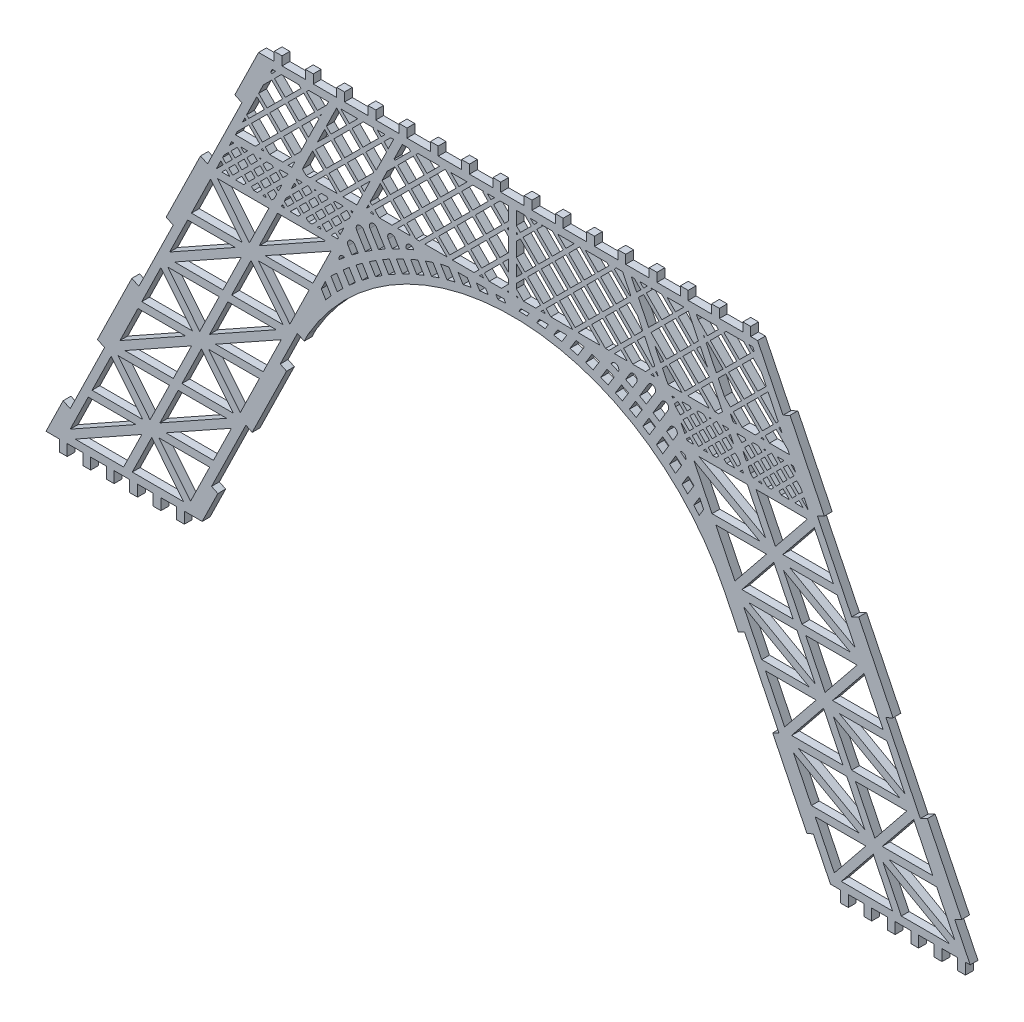
from build123d import *

# Parameters (mm, degrees)
BOSS_EXTRUDE1_DEPTH = 3


with BuildPart() as part:
    # Sketch1 → Boss-Extrude1 (new body)
    with BuildSketch(Plane.XY):
        with BuildLine():
            Line((95.389694534, 192.970900019), (92.969418566, 194.155421923))
            Line((92.969418566, 194.155421923), (99.563302279, 207.628383646))
            Line((99.563302279, 207.628383646), (102.17945353, 206.347997234))
            Line((102.17945353, 206.347997234), (103.652227216, 209.357244041))
            ThreePointArc((103.652227216, 209.357244041), (185.300477119, 254.57931336), (263.61828912, 203.807346792))
            Line((263.61828912, 203.807346792), (268.921820099, 192.97090002))
            Line((268.921820099, 192.97090002), (271.342096067, 194.155421924))
            Line((271.342096067, 194.155421924), (284.529863492, 167.209498479))
            Line((284.529863492, 167.209498479), (282.109587524, 166.024976574))
            Line((282.109587524, 166.024976574), (295.297354949, 139.079053128))
            Line((295.297354949, 139.079053128), (297.717630917, 140.263575033))
            Line((297.717630917, 140.263575033), (304.31151463, 126.79061331))
            Line((304.31151463, 126.79061331), (308.155757317, 126.79061331))
            Line((308.155757317, 126.79061331), (308.155757317, 122.449462059))
            Line((308.155757317, 122.449462059), (311.155757317, 122.449462059))
            Line((311.155757317, 122.449462059), (311.155757317, 126.79061331))
            Line((311.155757317, 126.79061331), (317.155757317, 126.79061331))
            Line((317.155757317, 126.79061331), (317.155757317, 122.449462059))
            Line((317.155757317, 122.449462059), (320.155757317, 122.449462059))
            Line((320.155757317, 122.449462059), (320.155757317, 126.79061331))
            Line((320.155757317, 126.79061331), (326.155757317, 126.79061331))
            Line((326.155757317, 126.79061331), (326.155757317, 122.449462059))
            Line((326.155757317, 122.449462059), (329.155757317, 122.449462059))
            Line((329.155757317, 122.449462059), (329.155757317, 126.79061331))
            Line((329.155757317, 126.79061331), (335.155757317, 126.79061331))
            Line((335.155757317, 126.79061331), (335.155757317, 122.449462059))
            Line((335.155757317, 122.449462059), (338.155757317, 122.449462059))
            Line((338.155757317, 122.449462059), (338.155757317, 126.79061331))
            Line((338.155757317, 126.79061331), (344.155757317, 126.79061331))
            Line((344.155757317, 126.79061331), (344.155757317, 122.449462059))
            Line((344.155757317, 122.449462059), (347.155757317, 122.449462059))
            Line((347.155757317, 122.449462059), (347.155757317, 126.79061331))
            Line((347.155757317, 126.79061331), (353.155757317, 126.79061331))
            Line((353.155757317, 126.79061331), (353.155757317, 122.449462059))
            Line((353.155757317, 122.449462059), (356.155757317, 122.449462059))
            Line((356.155757317, 122.449462059), (356.155757317, 126.790613309))
            Line((356.155757317, 126.790613309), (357.971491781, 126.790613309))
            Line((357.971491781, 126.790613309), (352.023038573, 138.944798289))
            Line((352.023038573, 138.944798289), (354.717630917, 140.263575032))
            Line((354.717630917, 140.263575032), (341.529863492, 167.209498478))
            Line((341.529863492, 167.209498478), (338.835271148, 165.890721735))
            Line((338.835271148, 165.890721735), (325.647503722, 192.836645181))
            Line((325.647503722, 192.836645181), (328.342096067, 194.155421923))
            Line((328.342096067, 194.155421923), (315.154328642, 221.101345369))
            Line((315.154328642, 221.101345369), (312.459736297, 219.782568627))
            Line((312.459736297, 219.782568627), (299.271968872, 246.728492072))
            Line((299.271968872, 246.728492072), (301.966561217, 248.047268815))
            Line((301.966561217, 248.047268815), (288.778793792, 274.99319226))
            Line((288.778793792, 274.99319226), (286.084201447, 273.674415518))
            Line((286.084201447, 273.674415518), (276.315734467, 293.633848751))
            Line((276.315734467, 293.633848751), (273.655757317, 293.633848751))
            Line((273.655757317, 293.633848751), (273.655757317, 297.000000002))
            Line((273.655757317, 297.000000002), (270.655757317, 297.000000002))
            Line((270.655757317, 297.000000002), (270.655757317, 293.633848751))
            Line((270.655757317, 293.633848751), (261.655757317, 293.633848751))
            Line((261.655757317, 293.633848751), (261.655757317, 297.000000002))
            Line((261.655757317, 297.000000002), (258.655757317, 297.000000002))
            Line((258.655757317, 297.000000002), (258.655757317, 293.633848751))
            Line((258.655757317, 293.633848751), (249.655757317, 293.633848751))
            Line((249.655757317, 293.633848751), (249.655757317, 297.000000002))
            Line((249.655757317, 297.000000002), (246.655757317, 297.000000002))
            Line((246.655757317, 297.000000002), (246.655757317, 293.633848751))
            Line((246.655757317, 293.633848751), (237.655757317, 293.633848751))
            Line((237.655757317, 293.633848751), (237.655757317, 297.000000002))
            Line((237.655757317, 297.000000002), (234.655757317, 297.000000002))
            Line((234.655757317, 297.000000002), (234.655757317, 293.633848751))
            Line((234.655757317, 293.633848751), (225.655757317, 293.633848751))
            Line((225.655757317, 293.633848751), (225.655757317, 297.000000002))
            Line((225.655757317, 297.000000002), (222.655757317, 297.000000002))
            Line((222.655757317, 297.000000002), (222.655757317, 293.633848751))
            Line((222.655757317, 293.633848751), (213.655757317, 293.633848751))
            Line((213.655757317, 293.633848751), (213.655757317, 297.000000002))
            Line((213.655757317, 297.000000002), (210.655757317, 297.000000002))
            Line((210.655757317, 297.000000002), (210.655757317, 293.633848751))
            Line((210.655757317, 293.633848751), (201.655757317, 293.633848751))
            Line((201.655757317, 293.633848751), (201.655757317, 297.000000002))
            Line((201.655757317, 297.000000002), (198.655757317, 297.000000002))
            Line((198.655757317, 297.000000002), (198.655757317, 293.633848751))
            Line((198.655757317, 293.633848751), (189.655757317, 293.633848751))
            Line((189.655757317, 293.633848751), (189.655757317, 297.000000002))
            Line((189.655757317, 297.000000002), (186.655757317, 297.000000002))
            Line((186.655757317, 297.000000002), (186.655757317, 293.633848751))
            Line((186.655757317, 293.633848751), (177.655757317, 293.633848751))
            Line((177.655757317, 293.633848751), (177.655757317, 297.000000002))
            Line((177.655757317, 297.000000002), (174.655757317, 297.000000002))
            Line((174.655757317, 297.000000002), (174.655757317, 293.633848751))
            Line((174.655757317, 293.633848751), (165.655757317, 293.633848751))
            Line((165.655757317, 293.633848751), (165.655757317, 297.000000002))
            Line((165.655757317, 297.000000002), (162.655757317, 297.000000002))
            Line((162.655757317, 297.000000002), (162.655757317, 293.633848751))
            Line((162.655757317, 293.633848751), (153.655757317, 293.633848751))
            Line((153.655757317, 293.633848751), (153.655757317, 297.000000002))
            Line((153.655757317, 297.000000002), (150.655757317, 297.000000002))
            Line((150.655757317, 297.000000002), (150.655757317, 293.633848751))
            Line((150.655757317, 293.633848751), (141.655757317, 293.633848751))
            Line((141.655757317, 293.633848751), (141.655757317, 297.000000002))
            Line((141.655757317, 297.000000002), (138.655757317, 297.000000002))
            Line((138.655757317, 297.000000002), (138.655757317, 293.633848751))
            Line((138.655757317, 293.633848751), (129.655757317, 293.633848751))
            Line((129.655757317, 293.633848751), (129.655757317, 297.000000002))
            Line((129.655757317, 297.000000002), (126.655757317, 297.000000002))
            Line((126.655757317, 297.000000002), (126.655757317, 293.633848751))
            Line((126.655757317, 293.633848751), (117.655757317, 293.633848751))
            Line((117.655757317, 293.633848751), (117.655757317, 297.000000002))
            Line((117.655757317, 297.000000002), (114.655757317, 297.000000002))
            Line((114.655757317, 297.000000002), (114.655757317, 293.633848751))
            Line((114.655757317, 293.633848751), (105.655757317, 293.633848751))
            Line((105.655757317, 293.633848751), (105.655757317, 297.000000002))
            Line((105.655757317, 297.000000002), (102.655757317, 297.000000002))
            Line((102.655757317, 297.000000002), (102.655757317, 293.633848751))
            Line((102.655757317, 293.633848751), (93.655757317, 293.633848751))
            Line((93.655757317, 293.633848751), (93.655757317, 297.000000002))
            Line((93.655757317, 297.000000002), (90.655757317, 297.000000002))
            Line((90.655757317, 297.000000002), (90.655757317, 293.633848751))
            Line((90.655757317, 293.633848751), (84.655757317, 293.633848751))
            Line((84.655757317, 293.633848751), (75.532720841, 274.99319226))
            Line((75.532720841, 274.99319226), (78.227313186, 273.674415518))
            Line((78.227313186, 273.674415518), (65.039545761, 246.728492072))
            Line((65.039545761, 246.728492072), (62.344953416, 248.047268815))
            Line((62.344953416, 248.047268815), (49.157185991, 221.101345369))
            Line((49.157185991, 221.101345369), (51.851778336, 219.782568627))
            Line((51.851778336, 219.782568627), (38.664010911, 192.836645181))
            Line((38.664010911, 192.836645181), (35.969418566, 194.155421923))
            Line((35.969418566, 194.155421923), (22.781651141, 167.209498478))
            Line((22.781651141, 167.209498478), (25.476243486, 165.890721735))
            Line((25.476243486, 165.890721735), (12.28847606, 138.944798289))
            Line((12.28847606, 138.944798289), (9.593883716, 140.263575032))
            Line((9.593883716, 140.263575032), (3.000000003, 126.790613309))
            Line((3.000000003, 126.790613309), (8.155757317, 126.790613309))
            Line((8.155757317, 126.790613309), (8.155757317, 122.449462058))
            Line((8.155757317, 122.449462058), (11.155757317, 122.449462058))
            Line((11.155757317, 122.449462058), (11.155757317, 126.790613309))
            Line((11.155757317, 126.790613309), (17.155757317, 126.790613309))
            Line((17.155757317, 126.790613309), (17.155757317, 122.449462058))
            Line((17.155757317, 122.449462058), (20.155757317, 122.449462058))
            Line((20.155757317, 122.449462058), (20.155757317, 126.790613309))
            Line((20.155757317, 126.790613309), (26.155757317, 126.790613309))
            Line((26.155757317, 126.790613309), (26.155757317, 122.449462058))
            Line((26.155757317, 122.449462058), (29.155757317, 122.449462058))
            Line((29.155757317, 122.449462058), (29.155757317, 126.790613309))
            Line((29.155757317, 126.790613309), (35.155757317, 126.790613309))
            Line((35.155757317, 126.790613309), (35.155757317, 122.449462058))
            Line((35.155757317, 122.449462058), (38.155757317, 122.449462058))
            Line((38.155757317, 122.449462058), (38.155757317, 126.790613309))
            Line((38.155757317, 126.790613309), (44.155757317, 126.790613309))
            Line((44.155757317, 126.790613309), (44.155757317, 122.449462058))
            Line((44.155757317, 122.449462058), (47.155757317, 122.449462058))
            Line((47.155757317, 122.449462058), (47.155757317, 126.790613309))
            Line((47.155757317, 126.790613309), (53.155757317, 126.790613309))
            Line((53.155757317, 126.790613309), (53.155757317, 122.449462058))
            Line((53.155757317, 122.449462058), (56.155757317, 122.449462058))
            Line((56.155757317, 122.449462058), (56.155757317, 126.790613309))
            Line((56.155757317, 126.790613309), (63.000000003, 126.790613309))
            Line((63.000000003, 126.790613309), (69.014159684, 139.079053127))
            Line((69.014159684, 139.079053127), (66.593883716, 140.263575032))
            Line((66.593883716, 140.263575032), (79.781651141, 167.209498478))
            Line((79.781651141, 167.209498478), (82.201927109, 166.024976573))
            Line((82.201927109, 166.024976573), (95.389694534, 192.970900019))
        make_face()
        Polygon((12.307657907, 132.159485469), (19.22365868, 146.290613307), (37.53128398, 146.290613307), align=None, mode=Mode.SUBTRACT)
        Polygon((32.798236726, 129.790613307), (14.217293325, 129.790613307), (39.817487821, 144.132707502), align=None, mode=Mode.SUBTRACT)
        Polygon((55.861501173, 129.790613307), (36.138259576, 129.790613307), (43.58903224, 145.014414528), align=None, mode=Mode.SUBTRACT)
        Polygon((65.863567283, 146.290613307), (58.51604494, 131.277778444), (46.413643786, 146.290613307), align=None, mode=Mode.SUBTRACT)
        Polygon((20.691906831, 149.290613307), (28.039429173, 164.303448171), (40.141830328, 149.290613307), align=None, mode=Mode.SUBTRACT)
        Polygon((50.417214538, 165.790613307), (42.966441874, 150.566812087), (30.69397294, 165.790613307), align=None, mode=Mode.SUBTRACT)
        Polygon((49.024190133, 149.290613307), (74.247816207, 163.421741145), (67.331815434, 149.290613307), align=None, mode=Mode.SUBTRACT)
        Polygon((72.338180788, 165.790613307), (46.737986293, 151.448519112), (53.757237387, 165.790613307), align=None, mode=Mode.SUBTRACT)
        Polygon((33.304519288, 168.790613307), (58.904713783, 183.132707502), (51.885462689, 168.790613307), align=None, mode=Mode.SUBTRACT)
        Polygon((56.618509943, 185.290613307), (31.394883869, 171.159485469), (38.310884642, 185.290613307), align=None, mode=Mode.SUBTRACT)
        Polygon((55.225485538, 168.790613307), (62.676258202, 184.014414528), (74.948727136, 168.790613307), align=None, mode=Mode.SUBTRACT)
        Polygon((84.950793246, 185.290613307), (77.603270903, 170.277778444), (65.500869748, 185.290613307), align=None, mode=Mode.SUBTRACT)
        Polygon((39.779132793, 188.290613307), (47.126655136, 203.303448171), (59.22905629, 188.290613307), align=None, mode=Mode.SUBTRACT)
        Polygon((69.504440501, 204.790613307), (62.053667836, 189.566812087), (49.781198903, 204.790613307), align=None, mode=Mode.SUBTRACT)
        Polygon((91.425406751, 204.790613307), (65.825212255, 190.448519112), (72.84446335, 204.790613307), align=None, mode=Mode.SUBTRACT)
        Polygon((68.111416096, 188.290613307), (93.33504217, 202.421741145), (86.419041397, 188.290613307), align=None, mode=Mode.SUBTRACT)
        Polygon((317.897870841, 146.290613307), (305.795469686, 131.277778444), (298.447947343, 146.290613307), align=None, mode=Mode.SUBTRACT)
        Polygon((308.450013453, 129.790613307), (320.722482387, 145.014414528), (328.173255051, 129.790613307), align=None, mode=Mode.SUBTRACT)
        Polygon((324.494026806, 144.132707502), (350.094221301, 129.790613307), (331.5132779, 129.790613307), align=None, mode=Mode.SUBTRACT)
        Polygon((352.00385672, 132.159485469), (326.780230646, 146.290613307), (345.087855947, 146.290613307), align=None, mode=Mode.SUBTRACT)
        Polygon((290.063698419, 163.421741145), (315.287324493, 149.290613307), (296.979699192, 149.290613307), align=None, mode=Mode.SUBTRACT)
        Polygon((310.554277239, 165.790613307), (317.573528334, 151.448519112), (291.973333838, 165.790613307), align=None, mode=Mode.SUBTRACT)
        Polygon((333.617541686, 165.790613307), (321.345072753, 150.566812087), (313.894300088, 165.790613307), align=None, mode=Mode.SUBTRACT)
        Polygon((324.169684298, 149.290613307), (336.272085453, 164.303448171), (343.619607796, 149.290613307), align=None, mode=Mode.SUBTRACT)
        Polygon((289.36278749, 168.790613307), (301.635256424, 184.014414528), (309.086029088, 168.790613307), align=None, mode=Mode.SUBTRACT)
        Polygon((298.810644878, 185.290613307), (286.708243724, 170.277778444), (279.360721381, 185.290613307), align=None, mode=Mode.SUBTRACT)
        Polygon((312.426051937, 168.790613307), (305.406800843, 183.132707502), (331.006995339, 168.790613307), align=None, mode=Mode.SUBTRACT)
        Polygon((332.916630757, 171.159485469), (307.693004684, 185.290613307), (326.000629984, 185.290613307), align=None, mode=Mode.SUBTRACT)
        Polygon((270.976472457, 202.421741145), (296.20009853, 188.290613307), (277.89247323, 188.290613307), align=None, mode=Mode.SUBTRACT)
        Polygon((291.467051277, 204.790613307), (298.486302371, 190.448519112), (272.886107875, 204.790613307), align=None, mode=Mode.SUBTRACT)
        Polygon((314.530315724, 204.790613307), (302.25784679, 189.566812087), (294.807074126, 204.790613307), align=None, mode=Mode.SUBTRACT)
        Polygon((305.082458336, 188.290613307), (317.18485949, 203.303448171), (324.532381833, 188.290613307), align=None, mode=Mode.SUBTRACT)
        Polygon((52.39174525, 207.790613307), (77.991939746, 222.132707502), (70.972688652, 207.790613307), align=None, mode=Mode.SUBTRACT)
        Polygon((75.705735905, 224.290613307), (50.482109832, 210.159485469), (57.398110605, 224.290613307), align=None, mode=Mode.SUBTRACT)
        Polygon((74.312711501, 207.790613307), (81.763484165, 223.014414528), (94.035953099, 207.790613307), align=None, mode=Mode.SUBTRACT)
        Polygon((58.866358756, 227.290613307), (66.213881099, 242.303448171), (78.316282253, 227.290613307), align=None, mode=Mode.SUBTRACT)
        Polygon((68.868424865, 243.790613307), (88.591666463, 243.790613307), (81.140893799, 228.566812087), align=None, mode=Mode.SUBTRACT)
        Polygon((70.531292081, 246.790613307), (72.095631909, 248.354953136), (73.659971737, 246.790613307), align=None, mode=Mode.SUBTRACT)
        Polygon((86.281292081, 246.790613307), (86.994027811, 247.503349038), (87.706763542, 246.790613307), align=None, mode=Mode.SUBTRACT)
        Polygon((68.409971737, 246.790613307), (70.135100363, 250.315484682), (71.034971737, 249.415613307), align=None, mode=Mode.SUBTRACT)
        Polygon((78.909971737, 246.790613307), (75.781292081, 246.790613307), (78.23232986, 249.241651087), (79.796669688, 247.677311259), align=None, mode=Mode.SUBTRACT)
        Polygon((77.171669688, 250.302311259), (74.720631909, 247.851273479), (73.156292081, 249.415613307), (75.60732986, 251.866651087), align=None, mode=Mode.SUBTRACT)
        Polygon((74.546669688, 252.927311259), (72.095631909, 250.476273479), (70.832157591, 251.739747797), (71.408941918, 252.918263145), (72.98232986, 254.491651087), align=None, mode=Mode.SUBTRACT)
        Polygon((84.159971737, 246.790613307), (82.804687983, 246.790613307), (81.917990032, 247.677311259), (84.369027811, 250.128349038), (85.933367639, 248.56400921), align=None, mode=Mode.SUBTRACT)
        Polygon((90.68291202, 248.06355359), (89.619027811, 246.999669382), (88.054687983, 248.56400921), (90.505725762, 251.015046989), (91.594538052, 249.9262347), align=None, mode=Mode.SUBTRACT)
        Polygon((83.308367639, 251.18900921), (80.85732986, 248.73797143), (79.292990032, 250.302311259), (81.744027811, 252.753349038), align=None, mode=Mode.SUBTRACT)
        Polygon((89.445065591, 252.075707161), (86.994027811, 249.624669382), (85.429687983, 251.18900921), (87.880725763, 253.640046989), align=None, mode=Mode.SUBTRACT)
        Polygon((84.588095711, 224.290613307), (104.038019208, 224.290613307), (96.690496865, 209.277778444), align=None, mode=Mode.SUBTRACT)
        Polygon((110.293086177, 230.246781108), (112.509965815, 226.614619747), (110.444425921, 224.240392777), (108.729001795, 227.0509636), align=None, mode=Mode.SUBTRACT)
        Polygon((87.198642059, 227.290613307), (112.422268132, 241.421741145), (105.506267359, 227.290613307), align=None, mode=Mode.SUBTRACT)
        Polygon((91.931689312, 243.790613307), (110.512632714, 243.790613307), (84.912438218, 229.448519112), align=None, mode=Mode.SUBTRACT)
        with BuildLine():
            Line((114.864758938, 229.136296505), (112.45445198, 233.085371436))
            ThreePointArc((112.45445198, 233.085371436), (112.450667955, 233.091605251), (112.446914282, 233.097857388))
            ThreePointArc((112.446914282, 233.097857388), (113.481717873, 234.125502772), (114.531669295, 235.137666553))
            ThreePointArc((114.531669295, 235.137666553), (114.801851679, 234.921073967), (115.015167427, 234.648297025))
            Line((115.015167427, 234.648297025), (117.048409895, 231.317008944))
            ThreePointArc((117.048409895, 231.317008944), (115.947605482, 230.235643758), (114.864758938, 229.136296505))
        make_face(mode=Mode.SUBTRACT)
        with BuildLine():
            ThreePointArc((117.147771285, 237.534011264), (118.294330407, 238.531095028), (119.45618054, 239.510318251))
            Line((119.45618054, 239.510318251), (121.826493203, 235.626770439))
            ThreePointArc((121.826493203, 235.626770439), (120.670412948, 234.637729822), (119.530544539, 233.630047875))
            Line((119.530544539, 233.630047875), (117.147771285, 237.534011264))
        make_face(mode=Mode.SUBTRACT)
        with BuildLine():
            ThreePointArc((115.597233558, 240.164956685), (116.060636319, 241.746527754), (117.696330197, 241.948058653))
            ThreePointArc((117.696330197, 241.948058653), (116.640715332, 241.063649305), (115.597233558, 240.164956685))
        make_face(mode=Mode.SUBTRACT)
        with BuildLine():
            ThreePointArc((122.07120672, 241.605626144), (123.270085298, 242.518477897), (124.482830413, 243.412825398))
            Line((124.482830413, 243.412825398), (126.835056521, 239.558910807))
            ThreePointArc((126.835056521, 239.558910807), (125.625543645, 238.659058162), (124.430665213, 237.739861931))
            Line((124.430665213, 237.739861931), (122.07120672, 241.605626144))
        make_face(mode=Mode.SUBTRACT)
        Polygon((93.399937463, 246.790613307), (93.837042991, 247.683729761), (94.695065591, 246.825707161), (94.659971737, 246.790613307), align=None, mode=Mode.SUBTRACT)
        Polygon((107.281292081, 246.790613307), (108.029121665, 247.538442892), (108.776951249, 246.790613307), align=None, mode=Mode.SUBTRACT)
        Polygon((114.165819616, 248.425140843), (115.296480679, 247.29447978), (115.04988034, 246.790613307), (112.531292081, 246.790613307), align=None, mode=Mode.SUBTRACT)
        Polygon((98.206763542, 250.337405112), (95.755725762, 247.886367333), (94.534100219, 249.107992876), (95.191112143, 250.45043337), (96.642423714, 251.90174494), align=None, mode=Mode.SUBTRACT)
        Polygon((99.909971737, 246.790613307), (96.851479788, 246.790613307), (96.816385934, 246.825707161), (99.267423714, 249.27674494), (100.831763542, 247.712405112), align=None, mode=Mode.SUBTRACT)
        Polygon((93.681882201, 254.191203428), (92.29159528, 251.350497815), (91.566385934, 252.075707161), align=None, mode=Mode.SUBTRACT)
        Polygon((104.343461493, 251.224103063), (101.892423714, 248.773065284), (100.328083885, 250.337405112), (102.779121665, 252.788442892), align=None, mode=Mode.SUBTRACT)
        Polygon((105.159971737, 246.790613307), (103.87487569, 246.790613307), (102.953083885, 247.712405112), (105.404121665, 250.163442892), (106.968461493, 248.599103063), align=None, mode=Mode.SUBTRACT)
        Polygon((113.105159444, 249.485801015), (110.654121665, 247.034763235), (109.089781837, 248.599103063), (111.540819616, 251.050140843), align=None, mode=Mode.SUBTRACT)
        Polygon((110.480159444, 252.110801015), (108.029121665, 249.659763235), (106.464781837, 251.224103063), (108.915819616, 253.675140843), align=None, mode=Mode.SUBTRACT)
        with BuildLine():
            Line((120.498985693, 244.181571346), (119.048335695, 246.558333162))
            ThreePointArc((119.048335695, 246.558333162), (119.547230624, 248.62015368), (121.609051142, 248.12125875))
            Line((121.609051142, 248.12125875), (122.915068741, 245.98146434))
            ThreePointArc((122.915068741, 245.98146434), (121.700328492, 245.090509864), (120.498985693, 244.181571346))
        make_face(mode=Mode.SUBTRACT)
        with BuildLine():
            ThreePointArc((127.210972746, 245.322802471), (128.461170937, 246.153006398), (129.723910938, 246.96400687))
            Line((129.723910938, 246.96400687), (132.068586037, 243.122463941))
            ThreePointArc((132.068586037, 243.122463941), (130.806678202, 242.310033799), (129.557945363, 241.477495262))
            Line((129.557945363, 241.477495262), (127.210972746, 245.322802471))
        make_face(mode=Mode.SUBTRACT)
        with BuildLine():
            ThreePointArc((132.284626386, 248.52693246), (133.583200026, 249.279222682), (134.893119089, 250.011579238))
            Line((134.893119089, 250.011579238), (137.240091706, 246.166272028))
            ThreePointArc((137.240091706, 246.166272028), (135.928766203, 245.436286039), (134.629301485, 244.68538953))
            Line((134.629301485, 244.68538953), (132.284626386, 248.52693246))
        make_face(mode=Mode.SUBTRACT)
        Polygon((117.464052426, 251.723373653), (115.993537908, 248.718742895), (115.226479788, 249.485801014), align=None, mode=Mode.SUBTRACT)
        Polygon((116.616857395, 252.997498966), (114.165819616, 250.546461186), (112.601479788, 252.110801015), (115.052517567, 254.561838794), align=None, mode=Mode.SUBTRACT)
        with BuildLine():
            Line((125.646452216, 247.886131088), (122.345277551, 253.294814023))
            ThreePointArc((122.345277551, 253.294814023), (122.84417248, 255.356634541), (124.905992998, 254.857739612))
            Line((124.905992998, 254.857739612), (128.160808375, 249.525012275))
            ThreePointArc((128.160808375, 249.525012275), (126.897554095, 248.714893731), (125.646452216, 247.886131088))
        make_face(mode=Mode.SUBTRACT)
        with BuildLine():
            ThreePointArc((137.565322018, 251.425781297), (138.912669101, 252.099524999), (140.270193188, 252.752520474))
            Line((140.270193188, 252.752520474), (142.628803863, 248.888145335))
            ThreePointArc((142.628803863, 248.888145335), (141.267584901, 248.241405868), (139.916944165, 247.572856243))
            Line((139.916944165, 247.572856243), (137.565322018, 251.425781297))
        make_face(mode=Mode.SUBTRACT)
        with BuildLine():
            ThreePointArc((143.040032885, 254.006753319), (144.436981372, 254.600641102), (145.842943242, 255.172863953))
            Line((145.842943242, 255.172863953), (148.222963414, 251.273411246))
            ThreePointArc((148.222963414, 251.273411246), (146.810890998, 250.711548239), (145.408117496, 250.126855972))
            Line((145.408117496, 250.126855972), (143.040032885, 254.006753319))
        make_face(mode=Mode.SUBTRACT)
        Polygon((80.683367639, 253.81400921), (78.23232986, 251.36297143), (76.667990032, 252.927311259), (79.119027811, 255.378349038), align=None, mode=Mode.SUBTRACT)
        Polygon((78.058367639, 256.43900921), (75.60732986, 253.98797143), (74.042990032, 255.552311259), (76.494027811, 258.003349038), align=None, mode=Mode.SUBTRACT)
        Polygon((73.442316106, 257.072957677), (74.282964341, 258.790613307), (75.159971737, 258.790613307), align=None, mode=Mode.SUBTRACT)
        Polygon((80.409971737, 258.790613307), (79.119027811, 257.499669382), (77.828083885, 258.790613307), align=None, mode=Mode.SUBTRACT)
        Polygon((86.820065591, 254.700707161), (84.369027811, 252.249669382), (82.804687983, 253.81400921), (85.255725762, 256.265046989), align=None, mode=Mode.SUBTRACT)
        Polygon((92.956763542, 255.587405112), (90.505725762, 253.136367333), (88.941385934, 254.700707161), (91.392423714, 257.15174494), align=None, mode=Mode.SUBTRACT)
        Polygon((84.195065591, 257.325707161), (81.744027811, 254.874669382), (80.179687983, 256.43900921), (82.531292081, 258.790613307), (82.730159444, 258.790613307), align=None, mode=Mode.SUBTRACT)
        Polygon((85.659971737, 258.790613307), (85.255725762, 258.386367333), (84.851479788, 258.790613307), align=None, mode=Mode.SUBTRACT)
        Polygon((90.331763542, 258.212405112), (87.880725763, 255.761367333), (86.316385934, 257.325707161), (87.781292081, 258.790613307), (89.753555347, 258.790613307), align=None, mode=Mode.SUBTRACT)
        Polygon((86.753555347, 261.790613307), (85.531292081, 261.790613307), (86.142423714, 262.40174494), align=None, mode=Mode.SUBTRACT)
        Polygon((75.751212492, 261.790613307), (76.441286288, 263.200607514), (80.892423714, 267.65174494), (85.081763542, 263.462405112), (83.409971737, 261.790613307), align=None, mode=Mode.SUBTRACT)
        Polygon((78.474660476, 267.355302046), (79.366537561, 269.177631093), (79.831763542, 268.712405112), align=None, mode=Mode.SUBTRACT)
        Polygon((92.105159444, 270.485801015), (86.142423714, 264.523065284), (81.953083885, 268.712405112), (87.915819616, 274.675140843), align=None, mode=Mode.SUBTRACT)
        Polygon((86.855159444, 275.735801014), (80.892423714, 269.773065284), (80.063594789, 270.601894209), (83.982256159, 278.608704299), align=None, mode=Mode.SUBTRACT)
        Polygon((93.878555347, 282.759196917), (87.915819616, 276.796461186), (84.679313388, 280.032967415), (86.505975026, 283.765296253), (89.689215518, 286.948536745), align=None, mode=Mode.SUBTRACT)
        Polygon((88.539349214, 287.919990784), (88.597974758, 288.039777505), (88.628555347, 288.009196917), align=None, mode=Mode.SUBTRACT)
        Polygon((89.86755486, 290.633848749), (91.253207179, 290.633848749), (89.689215518, 289.069857089), (89.295031987, 289.464040621), align=None, mode=Mode.SUBTRACT)
        Polygon((101.718461493, 253.849103063), (99.267423714, 251.398065284), (97.703083885, 252.962405112), (100.154121665, 255.413442892), align=None, mode=Mode.SUBTRACT)
        Polygon((97.224486331, 254.605127901), (98.452761589, 257.114802967), (99.093461493, 256.474103063), align=None, mode=Mode.SUBTRACT)
        Polygon((95.715256389, 258.345897959), (94.017423714, 256.648065284), (92.453083885, 258.212405112), (93.031292081, 258.790613307), (95.932907218, 258.790613307), align=None, mode=Mode.SUBTRACT)
        Polygon((101.409971737, 258.790613307), (100.154121665, 257.534763235), (99.149818818, 258.539066082), (99.272930067, 258.790613307), align=None, mode=Mode.SUBTRACT)
        Polygon((107.855159444, 254.735801015), (105.404121665, 252.284763235), (103.839781837, 253.849103063), (106.290819616, 256.300140843), align=None, mode=Mode.SUBTRACT)
        Polygon((113.991857395, 255.622498966), (111.540819616, 253.171461186), (109.976479788, 254.735801015), (112.427517567, 257.186838794), align=None, mode=Mode.SUBTRACT)
        Polygon((105.230159444, 257.360801015), (102.779121665, 254.909763235), (101.214781837, 256.474103063), (103.531292081, 258.790613307), (103.800347151, 258.790613307), align=None, mode=Mode.SUBTRACT)
        Polygon((106.659971737, 258.790613307), (106.290819616, 258.421461186), (105.921667495, 258.790613307), align=None, mode=Mode.SUBTRACT)
        Polygon((111.366857395, 258.247498966), (108.915819616, 255.796461186), (107.351479788, 257.360801015), (108.781292081, 258.790613307), (110.823743054, 258.790613307), align=None, mode=Mode.SUBTRACT)
        Polygon((96.031292081, 261.790613307), (98.415819616, 264.175140843), (98.51811595, 264.072844509), (97.401155369, 261.790613307), align=None, mode=Mode.SUBTRACT)
        Polygon((100.800347151, 261.790613307), (100.741178218, 261.790613307), (100.760620889, 261.83033957), align=None, mode=Mode.SUBTRACT)
        Polygon((114.847138956, 261.790613307), (106.531292081, 261.790613307), (110.689215518, 265.948536745), align=None, mode=Mode.SUBTRACT)
        Polygon((119.912199278, 256.725552986), (119.497426614, 255.878068184), (117.677517567, 254.058159137), (116.113177739, 255.622498966), (118.564215519, 258.073536745), align=None, mode=Mode.SUBTRACT)
        Polygon((117.159971737, 258.790613307), (115.052517567, 256.683159138), (113.488177739, 258.247498966), (114.031292081, 258.790613307), align=None, mode=Mode.SUBTRACT)
        Polygon((120.922872944, 258.790613307), (120.609256506, 258.149816101), (119.9684593, 258.790613307), align=None, mode=Mode.SUBTRACT)
        with BuildLine():
            Line((130.721523822, 251.087937864), (127.412701679, 256.509150515))
            ThreePointArc((127.412701679, 256.509150515), (127.911596609, 258.570971034), (129.973417127, 258.072076104))
            Line((129.973417127, 258.072076104), (133.328598559, 252.574907855))
            ThreePointArc((133.328598559, 252.574907855), (132.019548206, 251.841088666), (130.721523822, 251.087937864))
        make_face(mode=Mode.SUBTRACT)
        Polygon((127.531292081, 261.790613307), (128.236173714, 262.49549494), (128.941055347, 261.790613307), align=None, mode=Mode.SUBTRACT)
        Polygon((126.785907763, 263.945760891), (127.175513542, 263.556155112), (126.039000925, 262.419642496), align=None, mode=Mode.SUBTRACT)
        Polygon((93.909971737, 261.790613307), (88.87487569, 261.790613307), (87.203083885, 263.462405112), (93.165819616, 269.425140843), (97.355159444, 265.235801015), align=None, mode=Mode.SUBTRACT)
        Polygon((104.409971737, 261.790613307), (102.921667495, 261.790613307), (101.457678117, 263.254602685), (105.255800882, 271.015122109), (105.439215518, 271.198536745), (109.628555347, 267.009196917), align=None, mode=Mode.SUBTRACT)
        Polygon((100.747600758, 268.628242328), (98.415819616, 266.296461186), (94.226479788, 270.485801015), (100.189215518, 276.448536745), (103.133834549, 273.503917715), align=None, mode=Mode.SUBTRACT)
        Polygon((106.49987569, 272.259196917), (112.486173714, 278.24549494), (116.675513542, 274.056155112), (110.689215519, 268.069857089), align=None, mode=Mode.SUBTRACT)
        Polygon((122.986173714, 267.74549494), (124.543402824, 266.18826583), (122.391121095, 261.790613307), (117.031292081, 261.790613307), align=None, mode=Mode.SUBTRACT)
        Polygon((111.74987569, 267.009196917), (117.736173714, 272.99549494), (121.925513542, 268.806155112), (115.939215519, 262.819857089), align=None, mode=Mode.SUBTRACT)
        Polygon((131.06237569, 261.790613307), (129.296833885, 263.556155112), (135.259569616, 269.518890843), (139.448909444, 265.329551015), (135.909971737, 261.790613307), align=None, mode=Mode.SUBTRACT)
        Polygon((128.236173714, 264.616815284), (127.482964991, 265.370024006), (131.401626362, 273.376834097), (134.198909444, 270.579551015), align=None, mode=Mode.SUBTRACT)
        Polygon((118.796833885, 274.056155112), (124.759569616, 280.018890843), (128.948909444, 275.829551015), (122.986173714, 269.866815284), align=None, mode=Mode.SUBTRACT)
        Polygon((127.528741164, 272.288062391), (125.240460052, 267.612528945), (124.046833885, 268.806155112), align=None, mode=Mode.SUBTRACT)
        with BuildLine():
            Line((135.997932877, 253.993809881), (134.462701679, 256.509150515))
            ThreePointArc((134.462701679, 256.509150515), (134.961596608, 258.570971033), (137.023417127, 258.072076104))
            Line((137.023417127, 258.072076104), (138.69849475, 255.327609461))
            ThreePointArc((138.69849475, 255.327609461), (137.343251137, 254.670757668), (135.997932877, 253.993809881))
        make_face(mode=Mode.SUBTRACT)
        with BuildLine():
            Line((144.073417127, 258.072076104), (144.258061183, 257.769553136))
            ThreePointArc((144.258061183, 257.769553136), (142.85729238, 257.191557951), (141.465335451, 256.592652632))
            ThreePointArc((141.465335451, 256.592652632), (142.052968637, 258.595322342), (144.073417127, 258.072076104))
        make_face(mode=Mode.SUBTRACT)
        with BuildLine():
            ThreePointArc((148.712685203, 256.263415767), (150.160685581, 256.775153857), (151.616512144, 257.264183497))
            Line((151.616512144, 257.264183497), (154.028523408, 253.312316213))
            ThreePointArc((154.028523408, 253.312316213), (152.563946272, 252.838135787), (151.107357377, 252.339957048))
            Line((151.107357377, 252.339957048), (148.712685203, 256.263415767))
        make_face(mode=Mode.SUBTRACT)
        with BuildLine():
            Line((157.022142921, 254.199905606), (154.589724199, 258.185208706))
            Line((154.589724199, 258.185208706), (157.734859931, 258.79061331))
            Line((157.734859931, 258.79061331), (160.054610062, 254.989907738))
            ThreePointArc((160.054610062, 254.989907738), (158.535073523, 254.607585301), (157.022142921, 254.199905606))
        make_face(mode=Mode.SUBTRACT)
        Polygon((138.031292081, 261.790613307), (140.509569616, 264.268890843), (142.987847151, 261.790613307), align=None, mode=Mode.SUBTRACT)
        Polygon((152.782965518, 266.042286745), (156.972305347, 261.852946917), (156.909971737, 261.790613307), (148.531292081, 261.790613307), align=None, mode=Mode.SUBTRACT)
        with BuildLine():
            Line((163.16342375, 255.688761656), (161.270217174, 258.79061331))
            Line((161.270217174, 258.79061331), (164.784859931, 258.79061331))
            Line((164.784859931, 258.79061331), (166.314194389, 256.284933962))
            ThreePointArc((166.314194389, 256.284933962), (164.736258426, 256.000327959), (163.16342375, 255.688761656))
        make_face(mode=Mode.SUBTRACT)
        with BuildLine():
            Line((171.834859931, 258.79061331), (172.825155956, 257.168100795))
            ThreePointArc((172.825155956, 257.168100795), (171.201134459, 256.991253336), (169.580443101, 256.78611833))
            Line((169.580443101, 256.78611833), (168.357005136, 258.79061331))
            Line((168.357005136, 258.79061331), (171.834859931, 258.79061331))
        make_face(mode=Mode.SUBTRACT)
        with BuildLine():
            Line((176.55337242, 257.466205714), (175.745023908, 258.79061331))
            Line((175.745023908, 258.79061331), (178.884859931, 258.79061331))
            Line((178.884859931, 258.79061331), (179.611967962, 257.599311062))
            ThreePointArc((179.611967962, 257.599311062), (178.082126505, 257.545251623), (176.55337242, 257.466205714))
        make_face(mode=Mode.SUBTRACT)
        Polygon((169.531292081, 261.790613307), (170.329923714, 262.58924494), (171.128555347, 261.790613307), align=None, mode=Mode.SUBTRACT)
        Polygon((180.655757313, 262.41507854), (180.655757313, 261.790613307), (180.031292081, 261.790613307), align=None, mode=Mode.SUBTRACT)
        Polygon((145.109167495, 261.790613307), (141.570229788, 265.329551015), (147.532965518, 271.292286745), (151.722305347, 267.102946917), (146.409971737, 261.790613307), align=None, mode=Mode.SUBTRACT)
        Polygon((140.509569616, 266.390211186), (136.320229788, 270.579551015), (142.282965518, 276.542286745), (146.472305347, 272.352946917), align=None, mode=Mode.SUBTRACT)
        Polygon((148.59362569, 272.352946917), (154.579923714, 278.33924494), (158.769263542, 274.149905112), (152.782965519, 268.163607089), align=None, mode=Mode.SUBTRACT)
        Polygon((165.079923714, 267.83924494), (169.269263542, 263.649905112), (167.409971737, 261.790613307), (159.1559593, 261.790613307), (159.09362569, 261.852946917), align=None, mode=Mode.SUBTRACT)
        Polygon((153.84362569, 267.102946917), (159.829923714, 273.08924494), (164.019263542, 268.899905112), (158.032965519, 262.913607089), align=None, mode=Mode.SUBTRACT)
        Polygon((180.655757313, 266.310203146), (180.655757313, 264.536398883), (177.909971737, 261.790613307), (173.24987569, 261.790613307), (171.390583885, 263.649905112), (177.353319616, 269.612640843), align=None, mode=Mode.SUBTRACT)
        Polygon((160.890583885, 274.149905112), (166.853319616, 280.112640843), (171.042659444, 275.923301015), (165.079923714, 269.960565284), align=None, mode=Mode.SUBTRACT)
        Polygon((170.329923714, 264.710565284), (166.140583885, 268.899905112), (172.103319616, 274.862640843), (176.292659444, 270.673301015), align=None, mode=Mode.SUBTRACT)
        Polygon((180.655757313, 272.91507854), (180.655757313, 268.431523489), (178.413979788, 270.673301014), align=None, mode=Mode.SUBTRACT)
        Polygon((99.128555347, 277.509196917), (93.165819616, 271.546461186), (88.976479788, 275.735801015), (94.939215518, 281.698536745), align=None, mode=Mode.SUBTRACT)
        Polygon((101.24987569, 277.509196917), (107.236173714, 283.49549494), (107.765038094, 282.96663056), (103.830891777, 274.92818083), align=None, mode=Mode.SUBTRACT)
        Polygon((107.28917507, 275.16981664), (110.007543033, 280.724125621), (111.425513542, 279.306155112), align=None, mode=Mode.SUBTRACT)
        Polygon((95.99987569, 282.759196917), (101.986173714, 288.74549494), (106.175513542, 284.556155112), (100.189215519, 278.569857089), align=None, mode=Mode.SUBTRACT)
        Polygon((108.778915309, 285.038236536), (108.462095323, 284.390893675), (108.296833885, 284.556155112), align=None, mode=Mode.SUBTRACT)
        Polygon((113.546833885, 279.306155112), (119.509569616, 285.268890843), (123.698909444, 281.079551015), (117.736173714, 275.116815284), align=None, mode=Mode.SUBTRACT)
        Polygon((110.704600262, 282.148388736), (114.623261632, 290.155198827), (118.448909444, 286.329551015), (112.486173714, 280.366815284), align=None, mode=Mode.SUBTRACT)
        Polygon((133.774840021, 285.050412242), (129.856178651, 277.043602151), (125.820229788, 281.079551015), (131.782965518, 287.042286745), align=None, mode=Mode.SUBTRACT)
        Polygon((93.374527523, 290.633848749), (100.097819905, 290.633848749), (100.925513542, 289.806155112), (94.939215519, 283.819857089), (90.74987569, 288.009196917), align=None, mode=Mode.SUBTRACT)
        Polygon((110.812289497, 289.192931067), (107.236173714, 285.616815284), (103.046833885, 289.806155112), (103.874527523, 290.633848749), (111.517497738, 290.633848749), align=None, mode=Mode.SUBTRACT)
        Polygon((116.265932053, 290.633848749), (122.753207179, 290.633848749), (119.509569616, 287.390211186), align=None, mode=Mode.SUBTRACT)
        Polygon((130.722305347, 288.102946917), (124.759569616, 282.140211186), (120.570229788, 286.329551015), (124.874527523, 290.633848749), (128.894536124, 290.633848749), (128.542969819, 290.282282445), align=None, mode=Mode.SUBTRACT)
        Polygon((136.507463464, 290.633848749), (134.47189725, 286.474675357), (132.84362569, 288.102946917), (135.374527523, 290.633848749), align=None, mode=Mode.SUBTRACT)
        Polygon((131.782965518, 289.163607089), (130.312723858, 290.633848749), (133.253207179, 290.633848749), align=None, mode=Mode.SUBTRACT)
        Polygon((135.259569616, 271.640211186), (132.09868359, 274.801097212), (134.070315476, 278.829636703), (137.032965518, 281.792286745), (141.222305347, 277.602946917), align=None, mode=Mode.SUBTRACT)
        Polygon((143.34362569, 277.602946917), (149.329923714, 283.58924494), (153.519263542, 279.399905112), (147.532965519, 273.413607089), align=None, mode=Mode.SUBTRACT)
        Polygon((138.09362569, 282.852946917), (144.079923714, 288.83924494), (148.269263542, 284.649905112), (142.282965519, 278.663607089), align=None, mode=Mode.SUBTRACT)
        Polygon((150.390583885, 284.649905112), (156.353319616, 290.612640843), (160.542659444, 286.423301015), (154.579923714, 280.460565284), align=None, mode=Mode.SUBTRACT)
        Polygon((155.640583885, 279.399905112), (161.603319616, 285.362640843), (165.792659444, 281.173301015), (159.829923714, 275.210565284), align=None, mode=Mode.SUBTRACT)
        Polygon((180.655757313, 280.35699495), (180.655757313, 275.036398883), (177.353319616, 271.733961186), (173.163979788, 275.923301015), (179.126715518, 281.886036745), align=None, mode=Mode.SUBTRACT)
        Polygon((172.103319616, 276.983961186), (167.913979788, 281.173301015), (173.876715518, 287.136036745), (178.066055347, 282.946696917), align=None, mode=Mode.SUBTRACT)
        Polygon((180.655757313, 283.41507854), (180.655757313, 282.478315294), (180.18737569, 282.946696917), align=None, mode=Mode.SUBTRACT)
        Polygon((139.847486313, 290.633848749), (142.285319905, 290.633848749), (143.019263542, 289.899905112), (137.032965518, 283.913607089), (136.714402189, 284.232170418), align=None, mode=Mode.SUBTRACT)
        Polygon((145.874527523, 290.633848749), (154.253207179, 290.633848749), (149.329923714, 285.710565284), (145.140583885, 289.899905112), align=None, mode=Mode.SUBTRACT)
        Polygon((172.816055347, 288.196696917), (166.853319616, 282.233961186), (162.663979788, 286.423301015), (166.874527523, 290.633848749), (171.082036124, 290.633848749), (170.730469819, 290.282282445), align=None, mode=Mode.SUBTRACT)
        Polygon((158.453432053, 290.633848749), (164.753207179, 290.633848749), (161.603319616, 287.483961186), align=None, mode=Mode.SUBTRACT)
        Polygon((177.374527523, 290.633848749), (180.655757313, 290.633848749), (180.655757313, 285.536398883), (179.126715519, 284.007357089), (174.93737569, 288.196696917), align=None, mode=Mode.SUBTRACT)
        Polygon((172.500223858, 290.633848749), (175.253207179, 290.633848749), (173.876715518, 289.257357089), align=None, mode=Mode.SUBTRACT)
        Polygon((253.867088705, 224.240392777), (251.801548811, 226.614619747), (254.018428449, 230.246781108), (255.582512831, 227.0509636), align=None, mode=Mode.SUBTRACT)
        with BuildLine():
            Line((221.682710768, 248.888145335), (224.041321443, 252.752520474))
            ThreePointArc((224.041321443, 252.752520474), (225.39884553, 252.099524999), (226.746192613, 251.425781297))
            Line((226.746192613, 251.425781297), (224.394570466, 247.572856243))
            ThreePointArc((224.394570466, 247.572856243), (223.04392973, 248.241405868), (221.682710768, 248.888145335))
        make_face(mode=Mode.SUBTRACT)
        with BuildLine():
            Line((216.088551217, 251.273411246), (218.468571389, 255.172863953))
            ThreePointArc((218.468571389, 255.172863953), (219.87453326, 254.600641102), (221.271481747, 254.006753319))
            Line((221.271481747, 254.006753319), (218.903397135, 250.126855972))
            ThreePointArc((218.903397135, 250.126855972), (217.500623633, 250.711548239), (216.088551217, 251.273411246))
        make_face(mode=Mode.SUBTRACT)
        with BuildLine():
            Line((242.485021428, 235.626770439), (244.855334091, 239.510318251))
            ThreePointArc((244.855334091, 239.510318251), (246.017184224, 238.531095028), (247.163743346, 237.534011264))
            Line((247.163743346, 237.534011264), (244.780970092, 233.630047875))
            ThreePointArc((244.780970092, 233.630047875), (243.641101683, 234.637729822), (242.485021428, 235.626770439))
        make_face(mode=Mode.SUBTRACT)
        with BuildLine():
            Line((237.47645811, 239.558910807), (239.828684219, 243.412825398))
            ThreePointArc((239.828684219, 243.412825398), (241.041429333, 242.518477897), (242.240307911, 241.605626144))
            Line((242.240307911, 241.605626144), (239.880849418, 237.739861931))
            ThreePointArc((239.880849418, 237.739861931), (238.685970986, 238.659058162), (237.47645811, 239.558910807))
        make_face(mode=Mode.SUBTRACT)
        with BuildLine():
            Line((247.263104736, 231.317008944), (249.296347202, 234.648297028))
            ThreePointArc((249.296347202, 234.648297028), (249.50966295, 234.92107397), (249.779845334, 235.137666555))
            ThreePointArc((249.779845334, 235.137666555), (250.829796756, 234.125502774), (251.864600347, 233.097857391))
            ThreePointArc((251.864600347, 233.097857391), (251.860846673, 233.091605253), (251.857062649, 233.085371439))
            Line((251.857062649, 233.085371439), (249.44675569, 229.136296507))
            ThreePointArc((249.44675569, 229.136296507), (248.363909148, 230.235643759), (247.263104736, 231.317008944))
        make_face(mode=Mode.SUBTRACT)
        Polygon((251.889246494, 241.421741145), (277.112872568, 227.290613307), (258.805247267, 227.290613307), align=None, mode=Mode.SUBTRACT)
        Polygon((279.399076408, 229.448519112), (253.798881913, 243.790613307), (272.379825314, 243.790613307), align=None, mode=Mode.SUBTRACT)
        with BuildLine():
            ThreePointArc((246.615184434, 241.948058653), (248.250878312, 241.746527754), (248.714281074, 240.164956686))
            ThreePointArc((248.714281074, 240.164956686), (247.670799299, 241.063649305), (246.615184434, 241.948058653))
        make_face(mode=Mode.SUBTRACT)
        with BuildLine():
            Line((232.242928594, 243.122463941), (234.587603693, 246.96400687))
            ThreePointArc((234.587603693, 246.96400687), (235.850343694, 246.153006398), (237.100541885, 245.322802471))
            Line((237.100541885, 245.322802471), (234.753569268, 241.477495262))
            ThreePointArc((234.753569268, 241.477495262), (233.504836429, 242.310033799), (232.242928594, 243.122463941))
        make_face(mode=Mode.SUBTRACT)
        with BuildLine():
            Line((227.071422926, 246.166272028), (229.418395543, 250.011579238))
            ThreePointArc((229.418395543, 250.011579238), (230.728314605, 249.279222682), (232.026888245, 248.52693246))
            Line((232.026888245, 248.52693246), (229.682213147, 244.685389531))
            ThreePointArc((229.682213147, 244.685389531), (228.382748429, 245.436286039), (227.071422926, 246.166272028))
        make_face(mode=Mode.SUBTRACT)
        with BuildLine():
            ThreePointArc((242.702463489, 248.12125875), (244.764284007, 248.62015368), (245.263178937, 246.558333162))
            Line((245.263178937, 246.558333162), (243.812528939, 244.181571346))
            ThreePointArc((243.812528939, 244.181571346), (242.611186139, 245.090509864), (241.396445891, 245.98146434))
            Line((241.396445891, 245.98146434), (242.702463489, 248.12125875))
        make_face(mode=Mode.SUBTRACT)
        with BuildLine():
            ThreePointArc((239.405521633, 254.857739612), (241.467342151, 255.356634541), (241.96623708, 253.294814023))
            Line((241.96623708, 253.294814023), (238.665062415, 247.886131088))
            ThreePointArc((238.665062415, 247.886131088), (237.413960536, 248.714893731), (236.150706257, 249.525012275))
            Line((236.150706257, 249.525012275), (239.405521633, 254.857739612))
        make_face(mode=Mode.SUBTRACT)
        Polygon((249.015033947, 247.29447978), (250.14569501, 248.425140843), (251.780222546, 246.790613307), (249.261634286, 246.790613307), align=None, mode=Mode.SUBTRACT)
        Polygon((255.534563377, 246.790613307), (256.282392961, 247.538442892), (257.030222546, 246.790613307), align=None, mode=Mode.SUBTRACT)
        Polygon((249.085034839, 249.485801014), (248.317976719, 248.718742895), (246.8474622, 251.723373653), align=None, mode=Mode.SUBTRACT)
        Polygon((255.22173279, 248.599103063), (253.657392961, 247.034763235), (251.206355182, 249.485801015), (252.77069501, 251.050140843), align=None, mode=Mode.SUBTRACT)
        Polygon((251.710034838, 252.110801015), (250.14569501, 250.546461186), (247.694657231, 252.997498966), (249.258997059, 254.561838794), align=None, mode=Mode.SUBTRACT)
        Polygon((257.84673279, 251.224103063), (256.282392961, 249.659763235), (253.831355182, 252.110801015), (255.39569501, 253.675140843), align=None, mode=Mode.SUBTRACT)
        Polygon((261.358430741, 247.712405112), (260.436638936, 246.790613307), (259.151542889, 246.790613307), (257.343053133, 248.599103063), (258.907392961, 250.163442892), align=None, mode=Mode.SUBTRACT)
        Polygon((267.495128692, 246.825707161), (267.460034838, 246.790613307), (264.401542889, 246.790613307), (263.479751084, 247.712405112), (265.044090913, 249.27674494), align=None, mode=Mode.SUBTRACT)
        Polygon((269.777414407, 249.107992876), (268.555788864, 247.886367333), (266.104751084, 250.337405112), (267.669090913, 251.90174494), (269.120402483, 250.45043337), align=None, mode=Mode.SUBTRACT)
        Polygon((263.983430741, 250.337405112), (262.419090913, 248.773065284), (259.968053133, 251.224103063), (261.532392961, 252.788442892), align=None, mode=Mode.SUBTRACT)
        Polygon((260.273495418, 224.290613307), (279.723418915, 224.290613307), (267.621017761, 209.277778444), align=None, mode=Mode.SUBTRACT)
        Polygon((270.275561528, 207.790613307), (282.548030461, 223.014414528), (289.998803126, 207.790613307), align=None, mode=Mode.SUBTRACT)
        Polygon((293.338825975, 207.790613307), (286.31957488, 222.132707502), (311.919769376, 207.790613307), align=None, mode=Mode.SUBTRACT)
        Polygon((313.829404795, 210.159485469), (288.605778721, 224.290613307), (306.913404021, 224.290613307), align=None, mode=Mode.SUBTRACT)
        Polygon((283.170620827, 228.566812087), (275.719848163, 243.790613307), (295.443089761, 243.790613307), align=None, mode=Mode.SUBTRACT)
        Polygon((285.995232373, 227.290613307), (298.097633528, 242.303448171), (305.445155871, 227.290613307), align=None, mode=Mode.SUBTRACT)
        Polygon((269.616449036, 246.825707161), (270.474471636, 247.683729761), (270.911577163, 246.790613307), (269.651542889, 246.790613307), align=None, mode=Mode.SUBTRACT)
        Polygon((276.604751084, 246.790613307), (277.317486815, 247.503349038), (278.030222546, 246.790613307), align=None, mode=Mode.SUBTRACT)
        Polygon((276.256826643, 248.56400921), (274.692486815, 246.999669382), (273.628602607, 248.06355359), (272.716976575, 249.9262347), (273.805788864, 251.015046989), align=None, mode=Mode.SUBTRACT)
        Polygon((272.745128692, 252.075707161), (272.019919346, 251.350497815), (270.629632425, 254.191203428), align=None, mode=Mode.SUBTRACT)
        Polygon((278.881826643, 251.18900921), (277.317486815, 249.624669382), (274.866449036, 252.075707161), (276.430788864, 253.640046989), align=None, mode=Mode.SUBTRACT)
        Polygon((282.393524594, 247.677311259), (281.506826643, 246.790613307), (280.151542889, 246.790613307), (278.378146987, 248.56400921), (279.942486815, 250.128349038), align=None, mode=Mode.SUBTRACT)
        Polygon((286.079184766, 249.241651087), (288.530222546, 246.790613307), (285.401542889, 246.790613307), (284.514844938, 247.677311259), align=None, mode=Mode.SUBTRACT)
        Polygon((291.155222546, 249.415613307), (289.590882717, 247.851273479), (287.139844938, 250.302311259), (288.704184766, 251.866651087), align=None, mode=Mode.SUBTRACT)
        Polygon((285.018524594, 250.302311259), (283.454184766, 248.73797143), (281.003146987, 251.18900921), (282.567486815, 252.753349038), align=None, mode=Mode.SUBTRACT)
        Polygon((290.651542889, 246.790613307), (292.215882717, 248.354953136), (293.780222546, 246.790613307), align=None, mode=Mode.SUBTRACT)
        Polygon((293.276542889, 249.415613307), (294.176414263, 250.315484682), (295.901542889, 246.790613307), align=None, mode=Mode.SUBTRACT)
        Polygon((293.479357035, 251.739747797), (292.215882717, 250.476273479), (289.764844938, 252.927311259), (291.329184766, 254.491651087), (292.902572708, 252.918263145), align=None, mode=Mode.SUBTRACT)
        with BuildLine():
            ThreePointArc((187.758142211, 257.466205714), (186.229388127, 257.545251623), (184.699546669, 257.599311062))
            Line((184.699546669, 257.599311062), (185.4266547, 258.79061331))
            Line((185.4266547, 258.79061331), (188.566490723, 258.79061331))
            Line((188.566490723, 258.79061331), (187.758142211, 257.466205714))
        make_face(mode=Mode.SUBTRACT)
        with BuildLine():
            Line((195.954509495, 258.79061331), (194.73107153, 256.78611833))
            ThreePointArc((194.73107153, 256.78611833), (193.110380173, 256.991253336), (191.486358676, 257.168100795))
            Line((191.486358676, 257.168100795), (192.4766547, 258.79061331))
            Line((192.4766547, 258.79061331), (195.954509495, 258.79061331))
        make_face(mode=Mode.SUBTRACT)
        with BuildLine():
            ThreePointArc((201.148090882, 255.688761656), (199.575256205, 256.000327959), (197.997320242, 256.284933962))
            Line((197.997320242, 256.284933962), (199.5266547, 258.79061331))
            Line((199.5266547, 258.79061331), (203.041297457, 258.79061331))
            Line((203.041297457, 258.79061331), (201.148090882, 255.688761656))
        make_face(mode=Mode.SUBTRACT)
        Polygon((183.655757313, 262.41507854), (184.280222546, 261.790613307), (183.655757313, 261.790613307), align=None, mode=Mode.SUBTRACT)
        Polygon((193.18295928, 261.790613307), (193.981590913, 262.58924494), (194.780222546, 261.790613307), align=None, mode=Mode.SUBTRACT)
        with BuildLine():
            Line((210.282991223, 253.312316213), (212.695002487, 257.264183497))
            ThreePointArc((212.695002487, 257.264183497), (214.15082905, 256.775153857), (215.598829428, 256.263415767))
            Line((215.598829428, 256.263415767), (213.204157254, 252.339957048))
            ThreePointArc((213.204157254, 252.339957048), (211.74756836, 252.838135787), (210.282991223, 253.312316213))
        make_face(mode=Mode.SUBTRACT)
        with BuildLine():
            ThreePointArc((207.289371711, 254.199905606), (205.776441109, 254.607585301), (204.256904569, 254.989907738))
            Line((204.256904569, 254.989907738), (206.5766547, 258.79061331))
            Line((206.5766547, 258.79061331), (209.721790432, 258.185208706))
            Line((209.721790432, 258.185208706), (207.289371711, 254.199905606))
        make_face(mode=Mode.SUBTRACT)
        with BuildLine():
            ThreePointArc((222.84617918, 256.592652632), (221.454222251, 257.191557951), (220.053453448, 257.769553136))
            Line((220.053453448, 257.769553136), (220.238097505, 258.072076104))
            ThreePointArc((220.238097505, 258.072076104), (222.258545994, 258.595322341), (222.84617918, 256.592652632))
        make_face(mode=Mode.SUBTRACT)
        Polygon((207.401542889, 261.790613307), (207.33920928, 261.852946917), (211.528549108, 266.042286745), (215.780222546, 261.790613307), align=None, mode=Mode.SUBTRACT)
        Polygon((221.323667475, 261.790613307), (223.80194501, 264.268890843), (226.280222546, 261.790613307), align=None, mode=Mode.SUBTRACT)
        Polygon((191.061638936, 261.790613307), (186.401542889, 261.790613307), (183.655757313, 264.536398883), (183.655757313, 266.310203146), (186.95819501, 269.612640843), (192.920930741, 263.649905112), align=None, mode=Mode.SUBTRACT)
        Polygon((196.901542889, 261.790613307), (195.042251084, 263.649905112), (199.231590913, 267.83924494), (205.217888936, 261.852946917), (205.155555327, 261.790613307), align=None, mode=Mode.SUBTRACT)
        Polygon((183.655757313, 272.91507854), (185.897534839, 270.673301014), (183.655757313, 268.431523489), align=None, mode=Mode.SUBTRACT)
        Polygon((192.20819501, 274.862640843), (198.170930741, 268.899905112), (193.981590913, 264.710565284), (188.018855182, 270.673301015), align=None, mode=Mode.SUBTRACT)
        Polygon((193.268855182, 275.923301015), (197.45819501, 280.112640843), (203.420930741, 274.149905112), (199.231590913, 269.960565284), align=None, mode=Mode.SUBTRACT)
        Polygon((200.292251084, 268.899905112), (204.481590913, 273.08924494), (210.467888936, 267.102946917), (206.278549108, 262.913607089), align=None, mode=Mode.SUBTRACT)
        Polygon((216.778549108, 271.292286745), (222.741284839, 265.329551014), (219.202347131, 261.790613307), (217.901542889, 261.790613307), (212.58920928, 267.102946917), align=None, mode=Mode.SUBTRACT)
        Polygon((205.542251084, 274.149905112), (209.731590913, 278.33924494), (215.717888936, 272.352946917), (211.528549108, 268.163607089), align=None, mode=Mode.SUBTRACT)
        Polygon((222.028549108, 276.542286745), (227.991284838, 270.579551015), (223.80194501, 266.390211186), (217.83920928, 272.352946917), align=None, mode=Mode.SUBTRACT)
        with BuildLine():
            ThreePointArc((234.338097505, 258.072076104), (236.399918023, 258.570971034), (236.898812952, 256.509150515))
            Line((236.898812952, 256.509150515), (233.589990809, 251.087937864))
            ThreePointArc((233.589990809, 251.087937864), (232.291966426, 251.841088666), (230.982916072, 252.574907855))
            Line((230.982916072, 252.574907855), (234.338097505, 258.072076104))
        make_face(mode=Mode.SUBTRACT)
        with BuildLine():
            ThreePointArc((227.288097505, 258.072076104), (229.349918023, 258.570971034), (229.848812952, 256.509150515))
            Line((229.848812952, 256.509150515), (228.313581755, 253.993809881))
            ThreePointArc((228.313581755, 253.993809881), (226.968263495, 254.670757668), (225.613019881, 255.32760946))
            Line((225.613019881, 255.32760946), (227.288097505, 258.072076104))
        make_face(mode=Mode.SUBTRACT)
        Polygon((248.198336887, 255.622498966), (246.633997059, 254.058159137), (244.814088013, 255.878068184), (244.399315348, 256.725552986), (245.747299108, 258.073536745), align=None, mode=Mode.SUBTRACT)
        Polygon((243.388641682, 258.790613307), (244.343055327, 258.790613307), (243.70225812, 258.149816101), align=None, mode=Mode.SUBTRACT)
        Polygon((235.37045928, 261.790613307), (236.075340913, 262.49549494), (236.780222546, 261.790613307), align=None, mode=Mode.SUBTRACT)
        Polygon((238.272513701, 262.419642496), (237.136001084, 263.556155112), (237.525606864, 263.945760891), align=None, mode=Mode.SUBTRACT)
        Polygon((254.335034838, 254.735801015), (252.77069501, 253.171461186), (250.319657231, 255.622498966), (251.883997059, 257.186838794), align=None, mode=Mode.SUBTRACT)
        Polygon((250.823336887, 258.247498966), (249.258997059, 256.683159137), (247.151542889, 258.790613307), (250.280222546, 258.790613307), align=None, mode=Mode.SUBTRACT)
        Polygon((256.960034838, 257.360801015), (255.39569501, 255.796461186), (252.944657231, 258.247498966), (253.487771572, 258.790613307), (255.530222546, 258.790613307), align=None, mode=Mode.SUBTRACT)
        Polygon((258.389847131, 258.790613307), (258.02069501, 258.421461186), (257.651542889, 258.790613307), align=None, mode=Mode.SUBTRACT)
        Polygon((260.47173279, 253.849103063), (258.907392961, 252.284763235), (256.456355182, 254.735801015), (258.02069501, 256.300140843), align=None, mode=Mode.SUBTRACT)
        Polygon((266.608430741, 252.962405112), (265.044090913, 251.398065284), (262.593053133, 253.849103063), (264.157392961, 255.413442892), align=None, mode=Mode.SUBTRACT)
        Polygon((265.218053133, 256.474103063), (265.858753037, 257.114802967), (267.087028295, 254.605127901), align=None, mode=Mode.SUBTRACT)
        Polygon((263.09673279, 256.474103063), (261.532392961, 254.909763235), (259.081355182, 257.360801015), (260.511167475, 258.790613307), (260.780222546, 258.790613307), align=None, mode=Mode.SUBTRACT)
        Polygon((265.161695808, 258.539066082), (264.157392961, 257.534763235), (262.901542889, 258.790613307), (265.038584559, 258.790613307), align=None, mode=Mode.SUBTRACT)
        Polygon((249.46437567, 261.790613307), (253.622299108, 265.948536745), (257.780222546, 261.790613307), align=None, mode=Mode.SUBTRACT)
        Polygon((263.511167475, 261.790613307), (263.550893738, 261.83033957), (263.570336408, 261.790613307), align=None, mode=Mode.SUBTRACT)
        Polygon((265.793398677, 264.072844509), (265.89569501, 264.175140843), (268.280222546, 261.790613307), (266.910359257, 261.790613307), align=None, mode=Mode.SUBTRACT)
        Polygon((229.05194501, 269.518890843), (235.014680741, 263.556155112), (233.249138936, 261.790613307), (228.401542889, 261.790613307), (224.862605182, 265.329551015), align=None, mode=Mode.SUBTRACT)
        Polygon((232.909888265, 273.376834097), (236.828549635, 265.370024006), (236.075340913, 264.616815284), (230.112605182, 270.579551015), align=None, mode=Mode.SUBTRACT)
        Polygon((239.768111803, 266.18826583), (241.325340913, 267.74549494), (247.280222546, 261.790613307), (241.920393531, 261.790613307), align=None, mode=Mode.SUBTRACT)
        Polygon((236.782773462, 272.288062391), (240.264680741, 268.806155112), (239.071054574, 267.612528945), align=None, mode=Mode.SUBTRACT)
        Polygon((235.362605182, 275.829551015), (239.55194501, 280.018890843), (245.514680741, 274.056155112), (241.325340913, 269.866815284), align=None, mode=Mode.SUBTRACT)
        Polygon((242.386001084, 268.806155112), (246.575340913, 272.99549494), (252.561638936, 267.009196917), (248.372299108, 262.819857089), align=None, mode=Mode.SUBTRACT)
        Polygon((259.055713744, 271.015122109), (262.853836509, 263.254602685), (261.389847131, 261.790613307), (259.901542889, 261.790613307), (254.68295928, 267.009196917), (258.872299108, 271.198536745), align=None, mode=Mode.SUBTRACT)
        Polygon((247.636001084, 274.056155112), (251.825340913, 278.24549494), (257.811638936, 272.259196917), (253.622299108, 268.069857089), align=None, mode=Mode.SUBTRACT)
        Polygon((270.085034838, 270.485801015), (265.89569501, 266.296461186), (263.563913868, 268.628242328), (261.177680078, 273.503917715), (264.122299108, 276.448536745), align=None, mode=Mode.SUBTRACT)
        Polygon((191.147534838, 275.923301015), (186.95819501, 271.733961186), (183.655757313, 275.036398883), (183.655757313, 280.35699495), (185.184799108, 281.886036745), align=None, mode=Mode.SUBTRACT)
        Polygon((183.655757313, 283.41507854), (184.124138936, 282.946696917), (183.655757313, 282.478315294), align=None, mode=Mode.SUBTRACT)
        Polygon((190.434799108, 287.136036745), (196.397534838, 281.173301015), (192.20819501, 276.983961186), (186.24545928, 282.946696917), align=None, mode=Mode.SUBTRACT)
        Polygon((198.518855182, 281.173301015), (202.70819501, 285.362640843), (208.670930741, 279.399905112), (204.481590913, 275.210565284), align=None, mode=Mode.SUBTRACT)
        Polygon((210.792251084, 279.399905112), (214.981590913, 283.58924494), (220.967888936, 277.602946917), (216.778549108, 273.413607089), align=None, mode=Mode.SUBTRACT)
        Polygon((203.768855182, 286.423301015), (207.95819501, 290.612640843), (213.920930741, 284.649905112), (209.731590913, 280.460565284), align=None, mode=Mode.SUBTRACT)
        Polygon((216.042251084, 284.649905112), (220.231590913, 288.83924494), (226.217888936, 282.852946917), (222.028549108, 278.663607089), align=None, mode=Mode.SUBTRACT)
        Polygon((189.374138936, 288.196696917), (185.184799108, 284.007357089), (183.655757313, 285.536398883), (183.655757313, 290.633848749), (186.936987104, 290.633848749), align=None, mode=Mode.SUBTRACT)
        Polygon((191.811290768, 290.633848749), (190.434799108, 289.257357089), (189.058307447, 290.633848749), align=None, mode=Mode.SUBTRACT)
        Polygon((201.647534838, 286.423301015), (197.45819501, 282.233961186), (191.49545928, 288.196696917), (193.581044807, 290.282282445), (193.229478503, 290.633848749), (197.436987104, 290.633848749), align=None, mode=Mode.SUBTRACT)
        Polygon((205.858082573, 290.633848749), (202.70819501, 287.483961186), (199.558307447, 290.633848749), align=None, mode=Mode.SUBTRACT)
        Polygon((219.170930741, 289.899905112), (214.981590913, 285.710565284), (210.058307447, 290.633848749), (218.436987104, 290.633848749), align=None, mode=Mode.SUBTRACT)
        Polygon((221.292251084, 289.899905112), (222.026194722, 290.633848749), (224.464028313, 290.633848749), (227.597112437, 284.232170418), (227.278549108, 283.913607089), align=None, mode=Mode.SUBTRACT)
        Polygon((230.24119915, 278.829636703), (232.212831036, 274.801097212), (229.05194501, 271.640211186), (223.08920928, 277.602946917), (227.278549108, 281.792286745), align=None, mode=Mode.SUBTRACT)
        Polygon((240.612605182, 281.079551015), (244.80194501, 285.268890843), (250.764680741, 279.306155112), (246.575340913, 275.116815284), align=None, mode=Mode.SUBTRACT)
        Polygon((232.528549108, 287.042286745), (238.491284838, 281.079551015), (234.455335975, 277.043602151), (230.536674605, 285.050412242), align=None, mode=Mode.SUBTRACT)
        Polygon((252.886001084, 279.306155112), (254.303971593, 280.724125621), (257.022339557, 275.16981664), align=None, mode=Mode.SUBTRACT)
        Polygon((256.546476532, 282.96663056), (257.075340913, 283.49549494), (263.061638936, 277.509196917), (260.480622849, 274.92818083), align=None, mode=Mode.SUBTRACT)
        Polygon((245.862605182, 286.329551015), (249.688252994, 290.155198827), (253.606914365, 282.148388736), (251.825340913, 280.366815284), align=None, mode=Mode.SUBTRACT)
        Polygon((256.014680741, 284.556155112), (255.849419304, 284.390893675), (255.532599317, 285.038236536), align=None, mode=Mode.SUBTRACT)
        Polygon((258.136001084, 284.556155112), (262.325340913, 288.74549494), (268.311638936, 282.759196917), (264.122299108, 278.569857089), align=None, mode=Mode.SUBTRACT)
        Polygon((228.936987104, 290.633848749), (231.467888936, 288.102946917), (229.839617377, 286.474675357), (227.804051162, 290.633848749), align=None, mode=Mode.SUBTRACT)
        Polygon((233.998790768, 290.633848749), (232.528549108, 289.163607089), (231.058307447, 290.633848749), align=None, mode=Mode.SUBTRACT)
        Polygon((243.741284838, 286.329551015), (239.55194501, 282.140211186), (233.58920928, 288.102946917), (235.768544807, 290.282282445), (235.416978503, 290.633848749), (239.436987104, 290.633848749), align=None, mode=Mode.SUBTRACT)
        Polygon((248.045582573, 290.633848749), (244.80194501, 287.390211186), (241.558307447, 290.633848749), align=None, mode=Mode.SUBTRACT)
        Polygon((261.264680741, 289.806155112), (257.075340913, 285.616815284), (253.49922513, 289.192931067), (252.794016889, 290.633848749), (260.436987104, 290.633848749), align=None, mode=Mode.SUBTRACT)
        Polygon((263.386001084, 289.806155112), (264.213694722, 290.633848749), (270.936987104, 290.633848749), (273.561638936, 288.009196917), (269.372299108, 283.819857089), align=None, mode=Mode.SUBTRACT)
        Polygon((275.370128692, 254.700707161), (273.805788864, 253.136367333), (271.354751084, 255.587405112), (272.919090913, 257.15174494), align=None, mode=Mode.SUBTRACT)
        Polygon((281.506826643, 253.81400921), (279.942486815, 252.249669382), (277.491449036, 254.700707161), (279.055788864, 256.265046989), align=None, mode=Mode.SUBTRACT)
        Polygon((271.858430741, 258.212405112), (270.294090913, 256.648065284), (268.596258237, 258.345897959), (268.378607408, 258.790613307), (271.280222546, 258.790613307), align=None, mode=Mode.SUBTRACT)
        Polygon((277.995128692, 257.325707161), (276.430788864, 255.761367333), (273.979751085, 258.212405112), (274.55795928, 258.790613307), (276.530222546, 258.790613307), align=None, mode=Mode.SUBTRACT)
        Polygon((279.460034838, 258.790613307), (279.055788864, 258.386367333), (278.651542889, 258.790613307), align=None, mode=Mode.SUBTRACT)
        Polygon((287.643524594, 252.927311259), (286.079184766, 251.36297143), (283.628146987, 253.81400921), (285.192486815, 255.378349038), align=None, mode=Mode.SUBTRACT)
        Polygon((290.268524594, 255.552311259), (288.704184766, 253.98797143), (286.253146987, 256.43900921), (287.817486815, 258.003349038), align=None, mode=Mode.SUBTRACT)
        Polygon((284.131826643, 256.43900921), (282.567486815, 254.874669382), (280.116449036, 257.325707161), (281.581355182, 258.790613307), (281.780222546, 258.790613307), align=None, mode=Mode.SUBTRACT)
        Polygon((286.483430741, 258.790613307), (285.192486815, 257.499669382), (283.901542889, 258.790613307), align=None, mode=Mode.SUBTRACT)
        Polygon((290.86919852, 257.072957677), (289.151542889, 258.790613307), (290.028550285, 258.790613307), align=None, mode=Mode.SUBTRACT)
        Polygon((277.55795928, 261.790613307), (278.169090913, 262.40174494), (278.780222546, 261.790613307), align=None, mode=Mode.SUBTRACT)
        Polygon((271.14569501, 269.425140843), (277.108430741, 263.462405112), (275.436638936, 261.790613307), (270.401542889, 261.790613307), (266.956355182, 265.235801015), align=None, mode=Mode.SUBTRACT)
        Polygon((282.358430741, 268.712405112), (278.169090913, 264.523065284), (272.206355182, 270.485801015), (276.39569501, 274.675140843), align=None, mode=Mode.SUBTRACT)
        Polygon((279.229751084, 263.462405112), (283.419090913, 267.65174494), (287.870228339, 263.200607514), (288.560302134, 261.790613307), (280.901542889, 261.790613307), align=None, mode=Mode.SUBTRACT)
        Polygon((284.479751084, 268.712405112), (284.944977066, 269.177631093), (285.836854151, 267.355302046), align=None, mode=Mode.SUBTRACT)
        Polygon((284.247919837, 270.601894209), (283.419090913, 269.773065284), (277.456355182, 275.735801015), (280.329258467, 278.608704299), align=None, mode=Mode.SUBTRACT)
        Polygon((275.335034838, 275.735801015), (271.14569501, 271.546461186), (265.18295928, 277.509196917), (269.372299108, 281.698536745), align=None, mode=Mode.SUBTRACT)
        Polygon((279.632201239, 280.032967415), (276.39569501, 276.796461186), (270.43295928, 282.759196917), (274.622299108, 286.948536745), (277.8055396, 283.765296253), align=None, mode=Mode.SUBTRACT)
        Polygon((275.68295928, 288.009196917), (275.713539868, 288.039777505), (275.772165412, 287.919990784), align=None, mode=Mode.SUBTRACT)
        Polygon((275.01648264, 289.464040621), (274.622299108, 289.069857089), (273.058307447, 290.633848749), (274.443959766, 290.633848749), align=None, mode=Mode.SUBTRACT)
    extrude(amount=BOSS_EXTRUDE1_DEPTH)


solid = part.part
